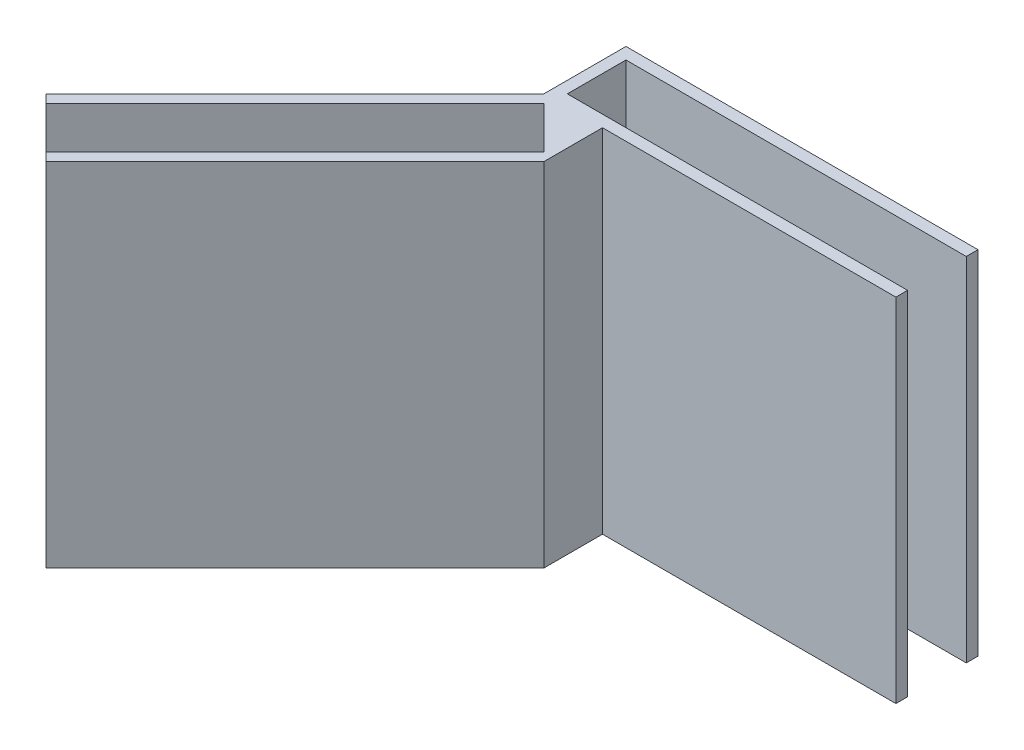
from build123d import *

# Parameters (mm, degrees)
SKETCH1_W           = 30
SKETCH1_H           = 30
BOSS_EXTRUDE1_DEPTH = 7
SHELL1_T            = -1
SKETCH2_W           = 30
SKETCH2_H           = 7
BOSS_EXTRUDE2_DEPTH = 30
SKETCH3_W           = 30
SKETCH3_H           = 7
BOSS_EXTRUDE3_DEPTH = 30
SKETCH5_W           = 5
SKETCH5_H           = 23
BOSS_EXTRUDE4_DEPTH = 5
CUT_EXTRUDE6_DEPTH  = 23
SKETCH12_W          = 7.071067812
SKETCH12_H          = 23
BOSS_EXTRUDE6_DEPTH = 30
CUT_EXTRUDE7_DEPTH  = 22
CUT_EXTRUDE8_DEPTH  = 22
SHELL2_START        = 24
SHELL2_DEPTH        = 5
SHELL2_START_2      = 23
SHELL2_2_DEPTH      = 1
SHELL2_START_3      = 1
SHELL2_3_DEPTH      = 22
BOSS_EXTRUDE7_DEPTH = 1
BOSS_EXTRUDE8_DEPTH = 23
CUT_EXTRUDE10_DEPTH = 1
CUT_EXTRUDE11_DEPTH = 7
BOSS_EXTRUDE9_DEPTH = 7
CUT_EXTRUDE12_DEPTH = 7
SKETCH23_W          = 29
SKETCH23_H          = 5
CUT_EXTRUDE14_DEPTH = 7
CUT_EXTRUDE15_DEPTH = 7


# Read off the part's stored shape, not the designer's step: Shell2
with BuildPart() as part:
    # Sketch1 → Boss-Extrude1 (new body)
    with BuildSketch(Plane.XY):
        with Locations((15, 15)):
            Rectangle(SKETCH1_W, SKETCH1_H)
    extrude(amount=BOSS_EXTRUDE1_DEPTH)

    # Shell1
    shell1_openings = [part.faces().sort_by_distance(p)[0] for p in [
        (30, 15, 3.5),
        (15, 0, 3.5),
    ]]
    offset(amount=SHELL1_T, openings=shell1_openings, kind=Kind.INTERSECTION)

    # Sketch2 → Boss-Extrude2 (add)
    with BuildSketch(Plane.XY.offset(7)):
        with Locations((15, 26.5)):
            Rectangle(SKETCH2_W, SKETCH2_H)
    extrude(amount=BOSS_EXTRUDE2_DEPTH)

    # Sketch3 → Boss-Extrude3 (add)
    with BuildSketch(Plane.ZY):
        with Locations((22, 26.5)):
            Rectangle(SKETCH3_W, SKETCH3_H)
    extrude(amount=BOSS_EXTRUDE3_DEPTH)

    # Sketch5 → Boss-Extrude4 (add)
    with BuildSketch(Plane.XY.offset(7)):
        with Locations((2.5, 11.5)):
            Rectangle(SKETCH5_W, SKETCH5_H)
    extrude(amount=BOSS_EXTRUDE4_DEPTH)

    # Sketch6 → Cut-Extrude6 (cut)
    with BuildSketch(Plane.XZ):
        Polygon((0, 12), (5, 12), (0, 7), align=None)
    extrude(amount=-CUT_EXTRUDE6_DEPTH, mode=Mode.SUBTRACT)

    # Sketch12 → Boss-Extrude6 (add)
    with BuildSketch(Plane(origin=(-3.5, 0, 3.5), x_dir=(0.7071067811865475, 0, 0.7071067811865477), z_dir=(-0.7071067811865477, 0, 0.7071067811865475))):
        with Locations((8.485281374, 11.5)):
            Rectangle(SKETCH12_W, SKETCH12_H)
    extrude(amount=BOSS_EXTRUDE6_DEPTH)

    # Sketch13 → Cut-Extrude7 (cut)
    with BuildSketch(Plane.XZ):
        Polygon((-19.798989873, 28.213203436), (0.707106781, 7.707106781), (4.292893219, 11.292893219), (-16.213203436, 31.798989873), (-16.920310217, 32.506096654), (-20.506096654, 28.920310217), align=None)
    extrude(amount=-CUT_EXTRUDE7_DEPTH, mode=Mode.SUBTRACT)

    # Sketch4 → Cut-Extrude8 (cut)
    with BuildSketch(Plane.XZ.offset(-23)):
        Polygon((-30, 37), (0, 7), (-30, 7), align=None)
    extrude(amount=-CUT_EXTRUDE8_DEPTH, mode=Mode.SUBTRACT)

    # Shell2 outline → Shell2 (cut)
    with BuildSketch(Plane(origin=(0, 0, 0), x_dir=(1, 0, 0), z_dir=(0, 1, 0)).offset(SHELL2_START)):
        Polygon((29, -37), (29, -7), (1, -7), (1, -7.414213562), (-28.585786438, -37), align=None)
    extrude(amount=SHELL2_DEPTH, mode=Mode.SUBTRACT)

    # Shell2 2 outline → Shell2 2 (cut)
    with BuildSketch(Plane(origin=(0, 0, 0), x_dir=(1, 0, 0), z_dir=(0, 1, 0)).offset(SHELL2_START_2)):
        Polygon((4, -7), (1, -7), (1, -7.414213562), (-19.798989873, -28.213203435), (-16.213203436, -31.798989873), (4, -11.585786438), align=None)
    extrude(amount=SHELL2_2_DEPTH, mode=Mode.SUBTRACT)

    # Shell2 3 outline → Shell2 3 (cut)
    with BuildSketch(Plane(origin=(0, 0, 0), x_dir=(1, 0, 0), z_dir=(0, 1, 0)).offset(SHELL2_START_3)):
        Polygon((4, -9.585786438), (4, -7), (1.414213562, -7), align=None)
    extrude(amount=SHELL2_3_DEPTH, mode=Mode.SUBTRACT)

    # Sketch16 → Boss-Extrude7 (add)
    with BuildSketch(Plane(origin=(0, 23, 0), x_dir=(1, 0, 0), z_dir=(0, 1, 0))):
        Polygon((1.414213562, -7), (1, -7), (1, -7.414213562), (-19.798989873, -28.213203436), (-16.213203436, -31.798989873), (4, -11.585786438), (4, -9.585786438), align=None)
    extrude(amount=BOSS_EXTRUDE7_DEPTH)

    # Sketch18 → Boss-Extrude8 (add)
    with BuildSketch(Plane(origin=(0, 1, 0), x_dir=(1, 0, 0), z_dir=(0, 1, 0))):
        Polygon((4, -9.585786438), (4, -7), (1.414213562, -7), align=None)
    extrude(amount=BOSS_EXTRUDE8_DEPTH)

    # Sketch19 → Cut-Extrude10 (cut)
    with BuildSketch(Plane(origin=(30, 0, 0), x_dir=(0, 0, -1), z_dir=(1, 0, 0))):
        Polygon((-36, 29), (-37, 29), (-37, 24), (-36, 24), (-7, 24), (-7, 29), align=None)
    extrude(amount=-CUT_EXTRUDE10_DEPTH, mode=Mode.SUBTRACT)

    # Sketch17 → Cut-Extrude11 (cut)
    with BuildSketch(Plane(origin=(0, 30, 0), x_dir=(1, 0, 0), z_dir=(0, 1, 0))):
        Polygon((0, -7), (30, -7), (30, -37), (-30, -37), align=None)
    extrude(amount=-CUT_EXTRUDE11_DEPTH, mode=Mode.SUBTRACT)

    # Sketch21 → Boss-Extrude9 (add)
    with BuildSketch(Plane(origin=(0, 23, 0), x_dir=(1, 0, 0), z_dir=(0, 1, 0))):
        Polygon((5, -12), (5, -7), (0, -7), (-21.213203436, -28.213203436), (-16.213203436, -33.213203436), align=None)
    extrude(amount=BOSS_EXTRUDE9_DEPTH)

    # Sketch22 → Cut-Extrude12 (cut)
    with BuildSketch(Plane.XZ.offset(-22)):
        Polygon((-16.920310217, 32.506096654), (-20.506096654, 28.920310217), (0.707106781, 7.707106781), (4.292893219, 11.292893219), align=None)
    extrude(amount=-CUT_EXTRUDE12_DEPTH, mode=Mode.SUBTRACT)

    # Sketch23 → Cut-Extrude14 (cut)
    with BuildSketch(Plane(origin=(0, 30, 0), x_dir=(1, 0, 0), z_dir=(0, 1, 0))):
        with Locations((15.5, -3.5)):
            Rectangle(SKETCH23_W, SKETCH23_H)
    extrude(amount=-CUT_EXTRUDE14_DEPTH, mode=Mode.SUBTRACT)

    # Sketch24 → Cut-Extrude15 (cut)
    with BuildSketch(Plane.XZ.offset(-29)):
        Polygon((4.292893219, 11.292893219), (-16.920310217, 32.506096654), (-20.506096654, 28.920310217), (0.707106781, 7.707106781), align=None)
    extrude(amount=-CUT_EXTRUDE15_DEPTH, mode=Mode.SUBTRACT)


solid = part.part
